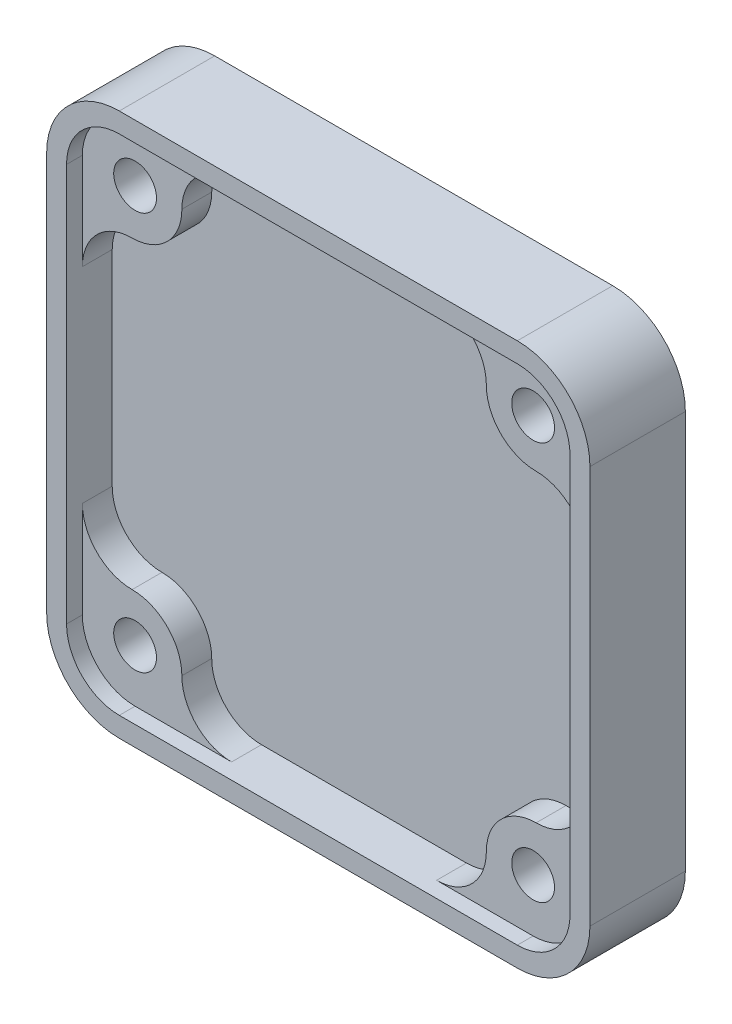
from build123d import *

# Parameters (mm, degrees)
WALL_EXTRUDE_BOSS_DEPTH         = 1.59
WALL_EXTRUDE_BOSS_DEPTH_BACK    = 8
FLOOR_EXTRUDE_BOSS_DEPTH        = 5
SCREWS_BLOCK_EXTRUDE_BOSS_DEPTH = 3
SCREWS_BLOCK_FILLET_R           = 5
SCREWS_HOLES_SKETCH_R           = 2.15
SCREWS_HOLES_EXTRUDE_DEPTH      = 75.39475788
SCREWS_HEADS_SKETCH_R           = 5
SCREWS_HEADS_EXTRUDE_DEPTH      = 3
CUT_EXTRUDE4_START              = -1
CUT_EXTRUDE4_DEPTH              = 1


# Read off the part's stored shape, not the designer's step: Screws_Block_Extrude_Boss, Cut-Extrude4
with BuildPart() as part:
    # Wall_Sketch → Wall-Extrude_Boss (new, two sides: drawn at the far end of the back side and taken through both)
    with BuildSketch(Plane.XY.offset(-WALL_EXTRUDE_BOSS_DEPTH_BACK)):
        with BuildLine():
            Line((-52.3, 44.999999897), (-52.29999, 5.00000605))
            ThreePointArc((-52.29999, 5.00000605), (-50.161874571, -0.161870293), (-45, -2.29999))
            Line((-45, -2.29999), (-5.000000575, -2.3))
            ThreePointArc((-5.000000575, -2.3), (0.161879299, -0.161879706), (2.3, 5))
            Line((2.3, 5), (2.3, 45))
            ThreePointArc((2.3, 45), (0.161879503, 50.161879503), (-5, 52.3))
            Line((-5, 52.3), (-45, 52.3))
            ThreePointArc((-45, 52.3), (-50.161879539, 50.161879466), (-52.3, 44.999999897))
        make_face()
        with BuildLine():
            Line((-5, 50.3), (-45, 50.3))
            ThreePointArc((-45, 50.3), (-48.747665967, 48.747665914), (-50.3, 44.999999925))
            Line((-50.3, 44.999999925), (-50.29999, 5.00000655))
            ThreePointArc((-50.29999, 5.00000655), (-48.747661185, 1.252343447), (-45, -0.29999))
            Line((-45, -0.29999), (-5.000000075, -0.3))
            ThreePointArc((-5.000000075, -0.3), (-1.252334086, 1.252334033), (0.3, 5))
            Line((0.3, 5), (0.3, 45))
            ThreePointArc((0.3, 45), (-1.25233406, 48.74766594), (-5, 50.3))
        make_face(mode=Mode.SUBTRACT)
    extrude(amount=WALL_EXTRUDE_BOSS_DEPTH + WALL_EXTRUDE_BOSS_DEPTH_BACK)

    # Floor_Sketch → Floor_Extrude_Boss (add)
    with BuildSketch(Plane(origin=(0, 0, -8), x_dir=(-1, 0, 0), z_dir=(0, 0, -1))):
        with BuildLine():
            Line((45, -0.29999), (5.000000075, -0.3))
            ThreePointArc((5.000000075, -0.3), (1.252334086, 1.252334033), (-0.3, 5))
            Line((-0.3, 5), (-0.3, 45))
            ThreePointArc((-0.3, 45), (1.25233406, 48.74766594), (5, 50.3))
            Line((5, 50.3), (45, 50.3))
            ThreePointArc((45, 50.3), (48.747665967, 48.747665914), (50.3, 44.999999925))
            Line((50.3, 44.999999925), (50.29999, 5.00000655))
            ThreePointArc((50.29999, 5.00000655), (48.747661185, 1.252343447), (45, -0.29999))
        make_face()
    extrude(amount=-FLOOR_EXTRUDE_BOSS_DEPTH)

    # Screws_Block_Extrude_Boss outline → Screws_Block_Extrude_Boss (add)
    with BuildSketch(Plane.XY.offset(-3)):
        with BuildLine():
            Line((-9.7, 9.700001175), (-9.7, -0.299998825))
            Line((-9.7, -0.299998825), (-5.000000075, -0.3))
            ThreePointArc((-5.000000075, -0.3), (-1.252334086, 1.252334033), (0.3, 5))
            Line((0.3, 5), (0.3, 9.700001175))
            Line((0.3, 9.700001175), (-9.7, 9.700001175))
        make_face()
        with BuildLine():
            Line((-45, -0.29999), (-40.299991175, -0.299991175))
            Line((-40.299991175, -0.299991175), (-40.299991175, 9.700008825))
            Line((-40.299991175, 9.700008825), (-50.299991175, 9.700008825))
            Line((-50.299991175, 9.700008825), (-50.29999, 5.00000655))
            ThreePointArc((-50.29999, 5.00000655), (-48.747661185, 1.252343447), (-45, -0.29999))
        make_face()
        with BuildLine():
            Line((-9.7, 40.3), (0.3, 40.3))
            Line((0.3, 40.3), (0.3, 45))
            ThreePointArc((0.3, 45), (-1.25233406, 48.74766594), (-5, 50.3))
            Line((-5, 50.3), (-9.7, 50.3))
            Line((-9.7, 50.3), (-9.7, 40.3))
        make_face()
        with BuildLine():
            Line((-50.3, 44.999999925), (-50.299998825, 40.3))
            Line((-50.299998825, 40.3), (-40.299998825, 40.3))
            Line((-40.299998825, 40.3), (-40.299998825, 50.3))
            Line((-40.299998825, 50.3), (-45, 50.3))
            ThreePointArc((-45, 50.3), (-48.747665967, 48.747665914), (-50.3, 44.999999925))
        make_face()
    extrude(amount=SCREWS_BLOCK_EXTRUDE_BOSS_DEPTH)

    # Screws_Block_Fillet
    screws_block_fillet_edges = [part.edges().sort_by_distance(p)[0] for p in [
        (-50.299991175, 9.700008825, -1.5),
        (-40.299991175, 9.700008825, -1.5),
        (-40.299991175, -0.299991175, -1.5),
        (-50.299998825, 40.3, -1.5),
        (-40.299998825, 40.3, -1.5),
        (-40.299998825, 50.3, -1.5),
        (-9.7, 50.3, -1.5),
        (-9.7, 40.3, -1.5),
        (0.3, 40.3, -1.5),
        (0.3, 9.700001175, -1.5),
        (-9.7, 9.700001175, -1.5),
        (-9.7, -0.299998825, -1.5),
    ]]
    fillet(screws_block_fillet_edges, radius=SCREWS_BLOCK_FILLET_R - 0.0001)  # a hair under: the kernel refuses the full size

    # Screws_Holes_Sketch → Screws_Holes_Extrude (cut, through all)
    with BuildSketch(Plane.XY):
        with Locations((-5, 5)):
            Circle(SCREWS_HOLES_SKETCH_R)
        with Locations((-45, 5)):
            Circle(SCREWS_HOLES_SKETCH_R)
        with Locations((-45, 45)):
            Circle(SCREWS_HOLES_SKETCH_R)
        with Locations((-5, 45)):
            Circle(SCREWS_HOLES_SKETCH_R)
    extrude(amount=-SCREWS_HOLES_EXTRUDE_DEPTH, mode=Mode.SUBTRACT)

    # Screws_Heads_Sketch → Screws_Heads_Extrude (cut)
    with BuildSketch(Plane(origin=(0, 0, -8), x_dir=(-1, 0, 0), z_dir=(0, 0, -1))):
        with Locations((45, 5)):
            Circle(SCREWS_HEADS_SKETCH_R)
        with Locations((5, 5)):
            Circle(SCREWS_HEADS_SKETCH_R)
        with Locations((5, 45)):
            Circle(SCREWS_HEADS_SKETCH_R)
        with Locations((45, 45)):
            Circle(SCREWS_HEADS_SKETCH_R)
    extrude(amount=-SCREWS_HEADS_EXTRUDE_DEPTH, mode=Mode.SUBTRACT)

    # Cut-Extrude4 outline → Cut-Extrude4 (cut)
    # profile 1 of 14: a face of its own
    with BuildSketch(Plane(origin=(0, 0, -8), x_dir=(-1, 0, 0), z_dir=(0, 0, -1)).offset(CUT_EXTRUDE4_START)):
        with BuildLine():
            ThreePointArc((19.123761695, 42.622498532), (18.934411444, 42.614903843), (18.745221079, 42.604031749))
            ThreePointArc((18.745221079, 42.604031749), (18.619538069, 42.592203309), (18.494705689, 42.5734148))
            ThreePointArc((18.494705689, 42.5734148), (18.087626591, 42.470620652), (17.698932182, 42.311886015))
            ThreePointArc((17.698932182, 42.311886015), (17.300891568, 42.087929952), (16.929634932, 41.821920255))
            ThreePointArc((16.929634932, 41.821920255), (16.582273109, 41.511117868), (16.270141999, 41.164949513))
            ThreePointArc((16.270141999, 41.164949513), (16.011325331, 40.801689535), (15.798724802, 40.409586367))
            ThreePointArc((15.798724802, 40.409586367), (15.6853018, 40.123326069), (15.606061538, 39.825784951))
            ThreePointArc((15.606061538, 39.825784951), (15.475921706, 39.165485257), (15.355293919, 38.503381792))
            ThreePointArc((15.355293919, 38.503381792), (15.159070376, 37.353469684), (14.972063775, 36.20202274))
            ThreePointArc((14.972063775, 36.20202274), (14.557345472, 33.574652855), (14.144970946, 30.946914086))
            Line((14.144970946, 30.946914086), (13.592079955, 27.413894941))
            Line((13.592079955, 27.413894941), (13.083114949, 24.162435465))
            Line((13.083114949, 24.162435465), (12.65627189, 21.436324101))
            Line((12.65627189, 21.436324101), (12.486328751, 20.352473169))
            ThreePointArc((12.486328751, 20.352473169), (12.375292894, 19.609879846), (12.275111645, 18.865744426))
            ThreePointArc((12.275111645, 18.865744426), (12.234683344, 18.432225131), (12.223399783, 17.996971059))
            ThreePointArc((12.223399783, 17.996971059), (12.243643483, 17.682469196), (12.299322501, 17.372273973))
            ThreePointArc((12.299322501, 17.372273973), (12.388882811, 17.077356444), (12.513420054, 16.795420506))
            ThreePointArc((12.513420054, 16.795420506), (12.641671398, 16.574357332), (12.791017084, 16.366961093))
            ThreePointArc((12.791017084, 16.366961093), (12.957806016, 16.178648993), (13.143100501, 16.008513904))
            ThreePointArc((13.143100501, 16.008513904), (13.341886898, 15.860907049), (13.555044655, 15.734940445))
            ThreePointArc((13.555044655, 15.734940445), (13.777539227, 15.633786256), (14.009726038, 15.557462673))
            ThreePointArc((14.009726038, 15.557462673), (14.142711858, 15.529832778), (14.278006197, 15.517829397))
            ThreePointArc((14.278006197, 15.517829397), (14.718184701, 15.505796966), (15.158427063, 15.496386429))
            ThreePointArc((15.158427063, 15.496386429), (15.723494794, 15.488387872), (16.288610035, 15.485181291))
            ThreePointArc((16.288610035, 15.485181291), (17.006182083, 15.485656305), (17.723745827, 15.489140798))
            Line((17.723745827, 15.489140798), (21.096939409, 15.512593896))
            Line((21.096939409, 15.512593896), (22.83747235, 20.523155813))
            Line((22.83747235, 20.523155813), (20.414647256, 20.571512746))
            ThreePointArc((20.414647256, 20.571512746), (19.949430871, 20.58112776), (19.484228588, 20.59140244))
            ThreePointArc((19.484228588, 20.59140244), (19.090883826, 20.600828364), (18.697562135, 20.611172328))
            Line((18.697562135, 20.611172328), (17.99097001, 20.630697503))
            ThreePointArc((17.99097001, 20.630697503), (17.980524729, 20.632893635), (17.971516234, 20.638618486))
            ThreePointArc((17.971516234, 20.638618486), (17.964776588, 20.645538808), (17.958808107, 20.653134263))
            ThreePointArc((17.958808107, 20.653134263), (17.938262816, 20.682473717), (17.917837458, 20.711896791))
            ThreePointArc((17.917837458, 20.711896791), (17.893829268, 20.746903426), (17.870076066, 20.782083579))
            ThreePointArc((17.870076066, 20.782083579), (17.843583735, 20.821848703), (17.817294628, 20.861748471))
            ThreePointArc((17.817294628, 20.861748471), (17.772687697, 20.954835972), (17.754155643, 21.056382139))
            ThreePointArc((17.754155643, 21.056382139), (17.751940897, 21.223854124), (17.761147971, 21.391087496))
            ThreePointArc((17.761147971, 21.391087496), (17.791783622, 21.68405394), (17.831239201, 21.975963409))
            ThreePointArc((17.831239201, 21.975963409), (17.932071843, 22.63811595), (18.035143302, 23.29992369))
            ThreePointArc((18.035143302, 23.29992369), (18.130210412, 23.904803633), (18.224914577, 24.509740507))
            Line((18.224914577, 24.509740507), (18.534636288, 26.493950226))
            Line((18.534636288, 26.493950226), (18.888566903, 28.765853079))
            Line((18.888566903, 28.765853079), (19.241578169, 31.036388406))
            ThreePointArc((19.241578169, 31.036388406), (19.586951938, 33.25505998), (19.933829888, 35.47349688))
            ThreePointArc((19.933829888, 35.47349688), (20.03795093, 36.105482584), (20.151968101, 36.735758085))
            ThreePointArc((20.151968101, 36.735758085), (20.219294178, 37.051078608), (20.301393346, 37.36287912))
            ThreePointArc((20.301393346, 37.36287912), (20.367912031, 37.490459319), (20.478787907, 37.582154373))
            ThreePointArc((20.478787907, 37.582154373), (20.581620409, 37.622233092), (20.691025378, 37.636772003))
            ThreePointArc((20.691025378, 37.636772003), (21.539992116, 37.646388357), (22.388976863, 37.654255822))
            ThreePointArc((22.388976863, 37.654255822), (23.568731809, 37.660954336), (24.748505586, 37.661614816))
            ThreePointArc((24.748505586, 37.661614816), (26.670313719, 37.656536197), (28.592113717, 37.648982295))
            Line((28.592113717, 37.648982295), (36.512871374, 37.612750922))
            Line((36.512871374, 37.612750922), (37.337097983, 39.9838204))
            ThreePointArc((37.337097983, 39.9838204), (37.495759016, 40.442082388), (37.653278487, 40.90073802))
            ThreePointArc((37.653278487, 40.90073802), (37.787524521, 41.295729879), (37.920229863, 41.691242026))
            ThreePointArc((37.920229863, 41.691242026), (38.03521891, 42.036765422), (38.149856847, 42.382405469))
            ThreePointArc((38.149856847, 42.382405469), (38.16037789, 42.424028902), (38.164802995, 42.466732778))
            ThreePointArc((38.164802995, 42.466732778), (38.147420747, 42.512167556), (38.102853481, 42.531666798))
            ThreePointArc((38.102853481, 42.531666798), (37.263157826, 42.544447381), (36.423444475, 42.556007034))
            ThreePointArc((36.423444475, 42.556007034), (35.215369871, 42.568446918), (34.007245224, 42.574264))
            ThreePointArc((34.007245224, 42.574264), (31.781812813, 42.577749373), (29.556378015, 42.578982607))
            ThreePointArc((29.556378015, 42.578982607), (27.870948513, 42.579790195), (26.185520338, 42.582053992))
            ThreePointArc((26.185520338, 42.582053992), (24.685311147, 42.58563383), (23.185107462, 42.59104992))
            ThreePointArc((23.185107462, 42.59104992), (21.917903203, 42.596836121), (20.650703239, 42.603496692))
            ThreePointArc((20.650703239, 42.603496692), (20.305409995, 42.608462683), (19.960257202, 42.61949148))
            ThreePointArc((19.960257202, 42.61949148), (19.754241264, 42.625943861), (19.548140363, 42.628516575))
            ThreePointArc((19.548140363, 42.628516575), (19.335925076, 42.627337687), (19.123761695, 42.622498532))
        make_face()
    # profile 2 of 14: a face of its own
    with BuildSketch(Plane(origin=(0, 0, -8), x_dir=(-1, 0, 0), z_dir=(0, 0, -1)).offset(CUT_EXTRUDE4_START)):
        with BuildLine():
            ThreePointArc((36.125034734, 12.571500526), (36.045323964, 12.550175375), (35.969318101, 12.518055636))
            ThreePointArc((35.969318101, 12.518055636), (35.901974952, 12.476940003), (35.841948991, 12.425729858))
            ThreePointArc((35.841948991, 12.425729858), (35.779931331, 12.345751915), (35.739780233, 12.252851156))
            ThreePointArc((35.739780233, 12.252851156), (35.707739685, 12.117321646), (35.689385254, 11.979271076))
            ThreePointArc((35.689385254, 11.979271076), (35.673662544, 11.731539613), (35.667269797, 11.483392047))
            ThreePointArc((35.667269797, 11.483392047), (35.664067543, 10.868458526), (35.663000351, 10.253517593))
            ThreePointArc((35.663000351, 10.253517593), (35.666624182, 9.420726364), (35.677496354, 8.587998222))
            ThreePointArc((35.677496354, 8.587998222), (35.705336811, 8.351701153), (35.779509695, 8.125626432))
            ThreePointArc((35.779509695, 8.125626432), (35.886974526, 7.988317087), (36.046720993, 7.918434239))
            ThreePointArc((36.046720993, 7.918434239), (36.383134185, 7.876537226), (36.721857169, 7.862539542))
            ThreePointArc((36.721857169, 7.862539542), (37.110299541, 7.874536999), (37.497261042, 7.910484356))
            ThreePointArc((37.497261042, 7.910484356), (37.662311334, 7.974511424), (37.777392164, 8.109038251))
            ThreePointArc((37.777392164, 8.109038251), (37.855900262, 8.323988139), (37.885191093, 8.550944133))
            ThreePointArc((37.885191093, 8.550944133), (37.896191248, 9.392244617), (37.89985835, 10.23360902))
            ThreePointArc((37.89985835, 10.23360902), (37.896243243, 11.071651144), (37.885397778, 11.909630886))
            ThreePointArc((37.885397778, 11.909630886), (37.856738917, 12.137999708), (37.779981103, 12.354983319))
            ThreePointArc((37.779981103, 12.354983319), (37.66767906, 12.489682426), (37.504886938, 12.554907603))
            ThreePointArc((37.504886938, 12.554907603), (37.134036002, 12.592221761), (36.761520777, 12.604678498))
            ThreePointArc((36.761520777, 12.604678498), (36.559088909, 12.602960877), (36.356715333, 12.597808481))
            ThreePointArc((36.356715333, 12.597808481), (36.240354333, 12.589240042), (36.125034734, 12.571500526))
        make_face()
        with BuildLine():
            ThreePointArc((36.968969941, 10.835758577), (36.978368655, 10.519850623), (36.984859417, 10.203869545))
            Line((36.984859417, 10.203869545), (37.009340843, 8.667808421))
            Line((37.009340843, 8.667808421), (36.55774355, 8.667808421))
            Line((36.55774355, 8.667808421), (36.55774355, 10.181415696))
            ThreePointArc((36.55774355, 10.181415696), (36.559746463, 10.676341169), (36.565755171, 11.171234219))
            ThreePointArc((36.565755171, 11.171234219), (36.57781847, 11.368640196), (36.607515251, 11.564172147))
            ThreePointArc((36.607515251, 11.564172147), (36.642240255, 11.653654538), (36.705486232, 11.725854749))
            ThreePointArc((36.705486232, 11.725854749), (36.783934067, 11.763419386), (36.87090367, 11.762213981))
            ThreePointArc((36.87090367, 11.762213981), (36.898180612, 11.745374605), (36.910655769, 11.715845525))
            ThreePointArc((36.910655769, 11.715845525), (36.927500431, 11.521132967), (36.942618143, 11.32627872))
            ThreePointArc((36.942618143, 11.32627872), (36.95816399, 11.081145967), (36.968969941, 10.835758577))
        make_face(mode=Mode.SUBTRACT)
    # profile 3 of 14: a face of its own
    with BuildSketch(Plane(origin=(0, 0, -8), x_dir=(-1, 0, 0), z_dir=(0, 0, -1)).offset(CUT_EXTRUDE4_START)):
        with BuildLine():
            ThreePointArc((34.850686979, 12.569319231), (34.429576841, 12.595834788), (34.007725432, 12.604678498))
            Line((34.007725432, 12.604678498), (33.068245073, 12.604678498))
            Line((33.068245073, 12.604678498), (33.068245073, 7.862539542))
            Line((33.068245073, 7.862539542), (33.962988272, 7.862539542))
            Line((33.962988272, 7.862539542), (33.965709097, 8.600702681))
            ThreePointArc((33.965709097, 8.600702681), (33.968267101, 8.876340795), (33.973909239, 9.151933029))
            ThreePointArc((33.973909239, 9.151933029), (33.992608396, 9.185050004), (34.030515526, 9.188122797))
            ThreePointArc((34.030515526, 9.188122797), (34.07634467, 9.154717216), (34.103300469, 9.104821042))
            ThreePointArc((34.103300469, 9.104821042), (34.191239561, 8.785952711), (34.276998756, 8.466491201))
            Line((34.276998756, 8.466491201), (34.436919519, 7.862539542))
            Line((34.436919519, 7.862539542), (35.380081925, 7.862539542))
            Line((35.380081925, 7.862539542), (34.934586781, 9.313178996))
            Line((34.934586781, 9.313178996), (35.119844971, 9.44293886))
            ThreePointArc((35.119844971, 9.44293886), (35.179892241, 9.497959882), (35.223675982, 9.566632813))
            ThreePointArc((35.223675982, 9.566632813), (35.257827655, 9.65762665), (35.277464275, 9.75281393))
            ThreePointArc((35.277464275, 9.75281393), (35.293838459, 9.92108804), (35.300554286, 10.090023494))
            ThreePointArc((35.300554286, 10.090023494), (35.303966035, 10.499875421), (35.305103071, 10.909739971))
            ThreePointArc((35.305103071, 10.909739971), (35.29945183, 11.476426311), (35.282499711, 12.042887228))
            ThreePointArc((35.282499711, 12.042887228), (35.245141689, 12.233794178), (35.151887604, 12.404512545))
            ThreePointArc((35.151887604, 12.404512545), (35.018714033, 12.518764993), (34.850686979, 12.569319231))
        make_face()
        with BuildLine():
            ThreePointArc((34.370767038, 11.439810448), (34.382217101, 11.183469249), (34.391348905, 10.927034999))
            Line((34.391348905, 10.927034999), (34.417075099, 10.09939754))
            Line((34.417075099, 10.09939754), (33.962988272, 10.09939754))
            Line((33.962988272, 10.09939754), (33.962988272, 10.955626608))
            ThreePointArc((33.962988272, 10.955626608), (33.963924728, 11.233390829), (33.966734383, 11.511142418))
            ThreePointArc((33.966734383, 11.511142418), (33.973158883, 11.603077751), (33.989869221, 11.693709668))
            ThreePointArc((33.989869221, 11.693709668), (34.011855801, 11.737455045), (34.050807317, 11.767117263))
            ThreePointArc((34.050807317, 11.767117263), (34.106408819, 11.783257208), (34.164305492, 11.783264067))
            ThreePointArc((34.164305492, 11.783264067), (34.223960075, 11.766458817), (34.27706613, 11.734508347))
            ThreePointArc((34.27706613, 11.734508347), (34.316266984, 11.691277429), (34.339973198, 11.637951688))
            ThreePointArc((34.339973198, 11.637951688), (34.360577171, 11.539690315), (34.370767038, 11.439810448))
        make_face(mode=Mode.SUBTRACT)
    # profile 4 of 14: a face of its own
    with BuildSketch(Plane(origin=(0, 0, -8), x_dir=(-1, 0, 0), z_dir=(0, 0, -1)).offset(CUT_EXTRUDE4_START)):
        with BuildLine():
            ThreePointArc((20.575881502, 12.577214982), (20.17563485, 12.597810601), (19.774917501, 12.604678498))
            Line((19.774917501, 12.604678498), (18.841828202, 12.604678498))
            Line((18.841828202, 12.604678498), (18.841828202, 7.862539542))
            Line((18.841828202, 7.862539542), (19.781308562, 7.862539542))
            ThreePointArc((19.781308562, 7.862539542), (20.196742392, 7.870293638), (20.611597503, 7.893545078))
            ThreePointArc((20.611597503, 7.893545078), (20.779938684, 7.937957567), (20.921175429, 8.039758374))
            ThreePointArc((20.921175429, 8.039758374), (21.01664325, 8.185480095), (21.053641981, 8.355715282))
            ThreePointArc((21.053641981, 8.355715282), (21.058818759, 8.771870633), (21.048525481, 9.187930874))
            ThreePointArc((21.048525481, 9.187930874), (21.039675061, 9.409907973), (21.032366688, 9.631941192))
            ThreePointArc((21.032366688, 9.631941192), (21.024782367, 9.906834436), (21.01821355, 10.18175382))
            ThreePointArc((21.01821355, 10.18175382), (21.012536448, 10.462727386), (21.00789224, 10.743719923))
            ThreePointArc((21.00789224, 10.743719923), (21.005025267, 10.98605562), (21.00354352, 11.228403746))
            ThreePointArc((21.00354352, 11.228403746), (20.996415129, 11.684413163), (20.978004417, 12.140106534))
            ThreePointArc((20.978004417, 12.140106534), (20.941695248, 12.301146094), (20.854037836, 12.441032741))
            ThreePointArc((20.854037836, 12.441032741), (20.728292864, 12.536357314), (20.575881502, 12.577214982))
        make_face()
        with BuildLine():
            ThreePointArc((20.144515248, 9.551555674), (20.156710808, 9.386197878), (20.166009306, 9.220651902))
            Line((20.166009306, 9.220651902), (20.19281268, 8.655066383))
            Line((20.19281268, 8.655066383), (19.942323506, 8.683805982))
            ThreePointArc((19.942323506, 8.683805982), (19.870008744, 8.696006997), (19.799387295, 8.715778199))
            ThreePointArc((19.799387295, 8.715778199), (19.757409285, 8.738834176), (19.7259814, 8.774973067))
            ThreePointArc((19.7259814, 8.774973067), (19.700772433, 8.829426512), (19.687567659, 8.887961148))
            ThreePointArc((19.687567659, 8.887961148), (19.674129433, 9.018100829), (19.664114024, 9.148548574))
            ThreePointArc((19.664114024, 9.148548574), (19.655881608, 9.329718914), (19.654205727, 9.511068455))
            ThreePointArc((19.654205727, 9.511068455), (19.664527216, 9.609990285), (19.693368279, 9.705175655))
            ThreePointArc((19.693368279, 9.705175655), (19.730259581, 9.76030649), (19.785736825, 9.796674779))
            ThreePointArc((19.785736825, 9.796674779), (19.860420412, 9.815715811), (19.937488582, 9.814881461))
            ThreePointArc((19.937488582, 9.814881461), (19.994557467, 9.800694792), (20.047538774, 9.775178126))
            ThreePointArc((20.047538774, 9.775178126), (20.085432433, 9.742310807), (20.110799087, 9.699035838))
            ThreePointArc((20.110799087, 9.699035838), (20.132915573, 9.626497906), (20.144515248, 9.551555674))
        make_face(mode=Mode.SUBTRACT)
        with BuildLine():
            ThreePointArc((20.110776361, 11.687935711), (20.136663224, 11.636185826), (20.153916046, 11.580954309))
            ThreePointArc((20.153916046, 11.580954309), (20.169577002, 11.493876619), (20.177473471, 11.405754911))
            ThreePointArc((20.177473471, 11.405754911), (20.182325487, 11.26230364), (20.183943001, 11.118779451))
            Line((20.183943001, 11.118779451), (20.183943001, 10.54676914))
            Line((20.183943001, 10.54676914), (19.647097082, 10.54676914))
            Line((19.647097082, 10.54676914), (19.647097082, 11.113439803))
            ThreePointArc((19.647097082, 11.113439803), (19.650082069, 11.334127796), (19.659034925, 11.554654317))
            ThreePointArc((19.659034925, 11.554654317), (19.67605766, 11.648002593), (19.715865791, 11.734136134))
            ThreePointArc((19.715865791, 11.734136134), (19.765440419, 11.779392083), (19.831273796, 11.792495938))
            ThreePointArc((19.831273796, 11.792495938), (19.938571902, 11.776496397), (20.042413685, 11.745099691))
            ThreePointArc((20.042413685, 11.745099691), (20.081354496, 11.722209577), (20.110776361, 11.687935711))
        make_face(mode=Mode.SUBTRACT)
    # profile 5 of 14: a face of its own
    with BuildSketch(Plane(origin=(0, 0, -8), x_dir=(-1, 0, 0), z_dir=(0, 0, -1)).offset(CUT_EXTRUDE4_START)):
        with BuildLine():
            Line((25.462927878, 10.822509936), (25.462927878, 12.604678498))
            Line((25.462927878, 12.604678498), (25.065573944, 12.604678498))
            ThreePointArc((25.065573944, 12.604678498), (24.987378172, 12.603023639), (24.909322434, 12.598061872))
            ThreePointArc((24.909322434, 12.598061872), (24.838638499, 12.590059073), (24.768515623, 12.578098899))
            ThreePointArc((24.768515623, 12.578098899), (24.712531309, 12.565288419), (24.657349149, 12.549373616))
            ThreePointArc((24.657349149, 12.549373616), (24.631674996, 12.535816406), (24.612298024, 12.514194819))
            ThreePointArc((24.612298024, 12.514194819), (24.596029628, 12.477767674), (24.589952617, 12.438338401))
            ThreePointArc((24.589952617, 12.438338401), (24.583908208, 12.10935925), (24.57852111, 11.780368678))
            ThreePointArc((24.57852111, 11.780368678), (24.574087267, 11.402112915), (24.572417798, 11.02383485))
            ThreePointArc((24.572417798, 11.02383485), (24.573106281, 10.583476117), (24.575841533, 10.14312534))
            Line((24.575841533, 10.14312534), (24.595307029, 7.862539542))
            Line((24.595307029, 7.862539542), (26.24478267, 7.862539542))
            Line((26.24478267, 7.862539542), (26.300242164, 8.198068241))
            ThreePointArc((26.300242164, 8.198068241), (26.328098762, 8.379235352), (26.35187511, 8.560982973))
            ThreePointArc((26.35187511, 8.560982973), (26.348919874, 8.625169714), (26.325342842, 8.684942574))
            ThreePointArc((26.325342842, 8.684942574), (26.285656518, 8.725589108), (26.231942747, 8.7440817))
            ThreePointArc((26.231942747, 8.7440817), (26.098438944, 8.753980445), (25.964609406, 8.757282741))
            ThreePointArc((25.964609406, 8.757282741), (25.87285478, 8.759239226), (25.78126695, 8.765105123))
            ThreePointArc((25.78126695, 8.765105123), (25.715803979, 8.774367622), (25.651762625, 8.790796242))
            ThreePointArc((25.651762625, 8.790796242), (25.606899297, 8.809227125), (25.565719019, 8.834851339))
            ThreePointArc((25.565719019, 8.834851339), (25.53693605, 8.863388659), (25.517237806, 8.898812057))
            ThreePointArc((25.517237806, 8.898812057), (25.501920765, 8.951330099), (25.495451704, 9.005652358))
            ThreePointArc((25.495451704, 9.005652358), (25.486670857, 9.263949894), (25.478881418, 9.522279229))
            ThreePointArc((25.478881418, 9.522279229), (25.471593546, 9.825781079), (25.466865016, 10.12933359))
            ThreePointArc((25.466865016, 10.12933359), (25.463912137, 10.475916172), (25.462927878, 10.822509936))
        make_face()
    # profile 6 of 14: a face of its own
    with BuildSketch(Plane(origin=(0, 0, -8), x_dir=(-1, 0, 0), z_dir=(0, 0, -1)).offset(CUT_EXTRUDE4_START)):
        with BuildLine():
            Line((31.323495923, 11.66519814), (31.371791835, 7.862539542))
            Line((31.371791835, 7.862539542), (32.259417352, 7.862539542))
            Line((32.259417352, 7.862539542), (32.307713353, 11.665198139))
            Line((32.307713353, 11.665198139), (32.559451142, 11.69405826))
            ThreePointArc((32.559451142, 11.69405826), (32.632174755, 11.704676427), (32.704105617, 11.719756895))
            ThreePointArc((32.704105617, 11.719756895), (32.737901209, 11.735329858), (32.763276506, 11.762546646))
            ThreePointArc((32.763276506, 11.762546646), (32.778292229, 11.799180389), (32.780461033, 11.838712646))
            ThreePointArc((32.780461033, 11.838712646), (32.76908476, 11.923248794), (32.754088478, 12.00721838))
            ThreePointArc((32.754088478, 12.00721838), (32.710113856, 12.209093742), (32.659594022, 12.409431395))
            ThreePointArc((32.659594022, 12.409431395), (32.624340019, 12.48388722), (32.565240757, 12.541278785))
            ThreePointArc((32.565240757, 12.541278785), (32.485173038, 12.580194976), (32.397487144, 12.595573323))
            ThreePointArc((32.397487144, 12.595573323), (32.131416481, 12.602401946), (31.865267941, 12.604678498))
            ThreePointArc((31.865267941, 12.604678498), (31.689117179, 12.603005021), (31.513030002, 12.597985282))
            ThreePointArc((31.513030002, 12.597985282), (31.391247336, 12.590005848), (31.270085391, 12.575360985))
            ThreePointArc((31.270085391, 12.575360985), (31.186723852, 12.559611211), (31.10484377, 12.537410899))
            ThreePointArc((31.10484377, 12.537410899), (31.056640866, 12.514283283), (31.016961645, 12.478450812))
            ThreePointArc((31.016961645, 12.478450812), (30.992759722, 12.445026992), (30.97316835, 12.408708085))
            ThreePointArc((30.97316835, 12.408708085), (30.949343874, 12.353361321), (30.927998492, 12.297012012))
            ThreePointArc((30.927998492, 12.297012012), (30.906818046, 12.232726408), (30.888438406, 12.167584724))
            ThreePointArc((30.888438406, 12.167584724), (30.873330083, 12.103128571), (30.861217544, 12.038042909))
            ThreePointArc((30.861217544, 12.038042909), (30.847616636, 11.943372899), (30.837467302, 11.848270919))
            ThreePointArc((30.837467302, 11.848270919), (30.84038627, 11.805884999), (30.856245546, 11.766469648))
            ThreePointArc((30.856245546, 11.766469648), (30.882265604, 11.737799851), (30.917316153, 11.721354191))
            ThreePointArc((30.917316153, 11.721354191), (30.991663193, 11.705560895), (31.066864516, 11.694530416))
            Line((31.066864516, 11.694530416), (31.323495923, 11.66519814))
        make_face()
    # profile 7 of 14: a face of its own
    with BuildSketch(Plane(origin=(0, 0, -8), x_dir=(-1, 0, 0), z_dir=(0, 0, -1)).offset(CUT_EXTRUDE4_START)):
        with BuildLine():
            ThreePointArc((29.140209332, 7.923494101), (29.444118736, 7.877816063), (29.751061788, 7.862539542))
            Line((29.751061788, 7.862539542), (30.450075707, 7.862539542))
            Line((30.450075707, 7.862539542), (30.505535201, 8.198068241))
            ThreePointArc((30.505535201, 8.198068241), (30.532331987, 8.374484093), (30.554510312, 8.551539853))
            ThreePointArc((30.554510312, 8.551539853), (30.550667249, 8.617491175), (30.525080419, 8.678398154))
            ThreePointArc((30.525080419, 8.678398154), (30.48219754, 8.721732773), (30.425253294, 8.743508527))
            ThreePointArc((30.425253294, 8.743508527), (30.281952745, 8.762306469), (30.137961095, 8.774748933))
            Line((30.137961095, 8.774748933), (29.712958075, 8.802019901))
            Line((29.712958075, 8.802019901), (29.712958075, 11.665198139))
            Line((29.712958075, 11.665198139), (30.584643384, 11.720625512))
            Line((30.584643384, 11.720625512), (30.530051344, 12.050809105))
            ThreePointArc((30.530051344, 12.050809105), (30.519252404, 12.118066611), (30.509079816, 12.185421698))
            ThreePointArc((30.509079816, 12.185421698), (30.499811777, 12.251093335), (30.491206426, 12.31685509))
            ThreePointArc((30.491206426, 12.31685509), (30.484384174, 12.373283981), (30.478099422, 12.429775261))
            ThreePointArc((30.478099422, 12.429775261), (30.475520392, 12.461261364), (30.474474549, 12.492835598))
            ThreePointArc((30.474474549, 12.492835598), (30.4645376, 12.524331115), (30.438682942, 12.544879768))
            ThreePointArc((30.438682942, 12.544879768), (30.378696775, 12.564910283), (30.31694284, 12.578548955))
            ThreePointArc((30.31694284, 12.578548955), (30.216649433, 12.591955198), (30.115703552, 12.598913936))
            ThreePointArc((30.115703552, 12.598913936), (29.95909449, 12.603237265), (29.802432395, 12.604678498))
            ThreePointArc((29.802432395, 12.604678498), (29.622237845, 12.602849697), (29.442117519, 12.59736442))
            ThreePointArc((29.442117519, 12.59736442), (29.333343396, 12.588390031), (29.225695871, 12.570380039))
            ThreePointArc((29.225695871, 12.570380039), (29.149094961, 12.548671529), (29.076186788, 12.516681578))
            ThreePointArc((29.076186788, 12.516681578), (29.01085218, 12.475906202), (28.952426356, 12.425729858))
            ThreePointArc((28.952426356, 12.425729858), (28.890408696, 12.345751915), (28.850257598, 12.252851156))
            ThreePointArc((28.850257598, 12.252851156), (28.81821705, 12.117321646), (28.799862619, 11.979271076))
            ThreePointArc((28.799862619, 11.979271076), (28.784139908, 11.731539613), (28.777747162, 11.483392047))
            ThreePointArc((28.777747162, 11.483392047), (28.774544908, 10.868458526), (28.773477716, 10.253517593))
            ThreePointArc((28.773477716, 10.253517593), (28.77701893, 9.43034831), (28.787640785, 8.607239943))
            ThreePointArc((28.787640785, 8.607239943), (28.81421997, 8.366444072), (28.884745475, 8.134678549))
            ThreePointArc((28.884745475, 8.134678549), (28.985971538, 7.997022928), (29.140209332, 7.923494101))
        make_face()
    # profile 8 of 14: a face of its own
    with BuildSketch(Plane(origin=(0, 0, -8), x_dir=(-1, 0, 0), z_dir=(0, 0, -1)).offset(CUT_EXTRUDE4_START)):
        with BuildLine():
            Line((26.626094037, 10.173959443), (26.626094037, 7.862539542))
            Line((26.626094037, 7.862539542), (28.303737536, 7.862539542))
            Line((28.303737536, 7.862539542), (28.359658986, 8.142146791))
            ThreePointArc((28.359658986, 8.142146791), (28.393074977, 8.325028858), (28.420376438, 8.508923145))
            ThreePointArc((28.420376438, 8.508923145), (28.417731894, 8.586673022), (28.390077034, 8.659386472))
            ThreePointArc((28.390077034, 8.659386472), (28.342638852, 8.711120207), (28.278009643, 8.738503155))
            ThreePointArc((28.278009643, 8.738503155), (28.134849721, 8.761036692), (27.990577416, 8.774748933))
            Line((27.990577416, 8.774748933), (27.565574397, 8.802019901))
            Line((27.565574397, 8.802019901), (27.565574397, 9.6967631))
            Line((27.565574397, 9.6967631), (28.236631796, 9.752302584))
            Line((28.236631796, 9.752302584), (28.236631796, 10.65023787))
            Line((28.236631796, 10.65023787), (27.565574397, 10.5915063))
            Line((27.565574397, 10.5915063), (27.565574397, 11.665198139))
            Line((27.565574397, 11.665198139), (28.035841043, 11.6922609))
            ThreePointArc((28.035841043, 11.6922609), (28.205091402, 11.704039953), (28.374010398, 11.719876701))
            ThreePointArc((28.374010398, 11.719876701), (28.420628686, 11.737377727), (28.452873332, 11.775322864))
            ThreePointArc((28.452873332, 11.775322864), (28.469123772, 11.829566942), (28.467526989, 11.886170362))
            ThreePointArc((28.467526989, 11.886170362), (28.419376381, 12.133789032), (28.369138611, 12.380992699))
            ThreePointArc((28.369138611, 12.380992699), (28.34822194, 12.44795392), (28.314658503, 12.509555933))
            ThreePointArc((28.314658503, 12.509555933), (28.274712591, 12.550343949), (28.22305371, 12.574648232))
            ThreePointArc((28.22305371, 12.574648232), (28.133025427, 12.592964484), (28.041437214, 12.600187782))
            ThreePointArc((28.041437214, 12.600187782), (27.787751037, 12.603555746), (27.534044988, 12.604678498))
            ThreePointArc((27.534044988, 12.604678498), (27.38076528, 12.6035973), (27.227516079, 12.600353847))
            ThreePointArc((27.227516079, 12.600353847), (27.093457542, 12.595161646), (26.959537538, 12.587156474))
            ThreePointArc((26.959537538, 12.587156474), (26.847876369, 12.578643393), (26.736323268, 12.568815133))
            ThreePointArc((26.736323268, 12.568815133), (26.708956298, 12.561338921), (26.685743614, 12.545028922))
            ThreePointArc((26.685743614, 12.545028922), (26.668216408, 12.51919875), (26.661472362, 12.488720585))
            ThreePointArc((26.661472362, 12.488720585), (26.65226134, 12.156328803), (26.643616062, 11.823921825))
            ThreePointArc((26.643616062, 11.823921825), (26.635534267, 11.444165715), (26.630394262, 11.064358396))
            ThreePointArc((26.630394262, 11.064358396), (26.627168993, 10.619164112), (26.626094037, 10.173959443))
        make_face()
    # profile 9 of 14: a face of its own
    with BuildSketch(Plane(origin=(0, 0, -8), x_dir=(-1, 0, 0), z_dir=(0, 0, -1)).offset(CUT_EXTRUDE4_START)):
        with BuildLine():
            Line((12.041779887, 10.05466038), (12.041779887, 7.862539542))
            Line((12.041779887, 7.862539542), (13.718377878, 7.862539542))
            Line((13.718377878, 7.862539542), (13.773837372, 8.198068241))
            ThreePointArc((13.773837372, 8.198068241), (13.800634158, 8.374484093), (13.822812484, 8.551539853))
            ThreePointArc((13.822812484, 8.551539853), (13.81896942, 8.617491175), (13.79338259, 8.678398154))
            ThreePointArc((13.79338259, 8.678398154), (13.750499711, 8.721732773), (13.693555465, 8.743508527))
            ThreePointArc((13.693555465, 8.743508527), (13.550254916, 8.762306469), (13.406263266, 8.774748933))
            Line((13.406263266, 8.774748933), (12.981260246, 8.802019901))
            Line((12.981260246, 8.802019901), (12.981260246, 11.665198139))
            Line((12.981260246, 11.665198139), (13.852945556, 11.720625512))
            Line((13.852945556, 11.720625512), (13.798353515, 12.050809105))
            ThreePointArc((13.798353515, 12.050809105), (13.787554575, 12.118066611), (13.777381987, 12.185421698))
            ThreePointArc((13.777381987, 12.185421698), (13.768113948, 12.251093335), (13.759508597, 12.31685509))
            ThreePointArc((13.759508597, 12.31685509), (13.752686345, 12.373283981), (13.746401593, 12.429775261))
            ThreePointArc((13.746401593, 12.429775261), (13.743822564, 12.461261364), (13.74277672, 12.492835598))
            ThreePointArc((13.74277672, 12.492835598), (13.732839771, 12.524331115), (13.706985113, 12.544879768))
            ThreePointArc((13.706985113, 12.544879768), (13.646998946, 12.564910283), (13.585245011, 12.578548955))
            ThreePointArc((13.585245011, 12.578548955), (13.484951604, 12.591955198), (13.384005724, 12.598913936))
            ThreePointArc((13.384005724, 12.598913936), (13.227396662, 12.603237265), (13.070734566, 12.604678498))
            ThreePointArc((13.070734566, 12.604678498), (12.890540016, 12.602849697), (12.71041969, 12.59736442))
            ThreePointArc((12.71041969, 12.59736442), (12.601645567, 12.588390031), (12.493998042, 12.570380039))
            ThreePointArc((12.493998042, 12.570380039), (12.417397133, 12.548671529), (12.344488959, 12.516681578))
            ThreePointArc((12.344488959, 12.516681578), (12.279154351, 12.475906202), (12.220728527, 12.425729858))
            ThreePointArc((12.220728527, 12.425729858), (12.157463687, 12.343280413), (12.117695447, 12.247265633))
            ThreePointArc((12.117695447, 12.247265633), (12.085909563, 12.101821227), (12.067800451, 11.954049518))
            ThreePointArc((12.067800451, 11.954049518), (12.052209083, 11.685608085), (12.045919864, 11.416787811))
            ThreePointArc((12.045919864, 11.416787811), (12.042814658, 10.735727242), (12.041779887, 10.05466038))
        make_face()
    # profile 10 of 14: a face of its own
    with BuildSketch(Plane(origin=(0, 0, -8), x_dir=(-1, 0, 0), z_dir=(0, 0, -1)).offset(CUT_EXTRUDE4_START)):
        with BuildLine():
            ThreePointArc((34.479853234, 30.922193137), (34.340768813, 30.906583413), (34.203315759, 30.880224402))
            ThreePointArc((34.203315759, 30.880224402), (34.140003524, 30.84812254), (34.098779063, 30.790334026))
            ThreePointArc((34.098779063, 30.790334026), (33.998875033, 30.530284795), (33.905191262, 30.267930514))
            ThreePointArc((33.905191262, 30.267930514), (33.601182117, 29.381841609), (33.298170901, 28.495410952))
            Line((33.298170901, 28.495410952), (32.637067072, 26.556619829))
            ThreePointArc((32.637067072, 26.556619829), (32.624949316, 26.50842407), (32.620873473, 26.458895708))
            ThreePointArc((32.620873473, 26.458895708), (32.629811247, 26.436820162), (32.65158956, 26.427180731))
            ThreePointArc((32.65158956, 26.427180731), (32.939355327, 26.418382428), (33.227145112, 26.410408322))
            ThreePointArc((33.227145112, 26.410408322), (33.56122967, 26.403618888), (33.895371365, 26.400805401))
            ThreePointArc((33.895371365, 26.400805401), (34.294316954, 26.401222098), (34.693249756, 26.404443337))
            Line((34.693249756, 26.404443337), (36.765626128, 26.428460929))
            Line((36.765626128, 26.428460929), (37.099404173, 27.412678448))
            ThreePointArc((37.099404173, 27.412678448), (37.178925706, 27.646497198), (37.258853495, 27.880177386))
            ThreePointArc((37.258853495, 27.880177386), (37.362276206, 28.181289368), (37.465946998, 28.482316027))
            ThreePointArc((37.465946998, 28.482316027), (37.574658977, 28.797143081), (37.683627819, 29.111881322))
            ThreePointArc((37.683627819, 29.111881322), (37.780902265, 29.391949395), (37.878499845, 29.671905027))
            Line((37.878499845, 29.671905027), (38.323817562, 30.946914086))
            Line((38.323817562, 30.946914086), (36.242450005, 30.946914086))
            ThreePointArc((36.242450005, 30.946914086), (35.620390286, 30.945889512), (34.998337323, 30.942814641))
            ThreePointArc((34.998337323, 30.942814641), (34.738924306, 30.936802641), (34.479853234, 30.922193137))
        make_face()
    # profile 11 of 14: a face of its own
    with BuildSketch(Plane(origin=(0, 0, -8), x_dir=(-1, 0, 0), z_dir=(0, 0, -1)).offset(CUT_EXTRUDE4_START)):
        with BuildLine():
            ThreePointArc((26.983991317, 36.307932061), (26.981179124, 36.234698514), (26.972759158, 36.161896281))
            Line((26.972759158, 36.161896281), (25.633848166, 27.510033577))
            ThreePointArc((25.633848166, 27.510033577), (25.040804232, 23.681007107), (24.446887296, 19.85211595))
            ThreePointArc((24.446887296, 19.85211595), (24.217018639, 18.384690091), (23.983091969, 16.91790566))
            ThreePointArc((23.983091969, 16.91790566), (23.940774404, 16.654166778), (23.89868789, 16.390390928))
            ThreePointArc((23.89868789, 16.390390928), (23.862982643, 16.164962948), (23.82759258, 15.939485272))
            Line((23.82759258, 15.939485272), (23.765399875, 15.540779023))
            ThreePointArc((23.765399875, 15.540779023), (23.763537751, 15.524780067), (23.762915799, 15.508685121))
            ThreePointArc((23.762915799, 15.508685121), (23.767776782, 15.496872735), (23.779543886, 15.491903139))
            Line((23.779543886, 15.491903139), (25.111398664, 15.479850053))
            ThreePointArc((25.111398664, 15.479850053), (25.852310556, 15.47429045), (26.593235041, 15.470790599))
            ThreePointArc((26.593235041, 15.470790599), (27.473364162, 15.468590519), (28.353495726, 15.467856736))
            Line((28.353495726, 15.467856736), (32.944075743, 15.467856736))
            Line((32.944075743, 15.467856736), (33.8053976, 17.946704028))
            ThreePointArc((33.8053976, 17.946704028), (33.970024395, 18.424054998), (34.132439303, 18.902163069))
            ThreePointArc((34.132439303, 18.902163069), (34.268140518, 19.309727241), (34.400785314, 19.718296368))
            ThreePointArc((34.400785314, 19.718296368), (34.515698213, 20.07771303), (34.630089117, 20.437296166))
            ThreePointArc((34.630089117, 20.437296166), (34.632906491, 20.467813111), (34.622733523, 20.496722146))
            ThreePointArc((34.622733523, 20.496722146), (34.601412773, 20.517458874), (34.572829847, 20.525680957))
            ThreePointArc((34.572829847, 20.525680957), (34.243392403, 20.536673431), (33.913932992, 20.546986582))
            ThreePointArc((33.913932992, 20.546986582), (33.536632222, 20.556641524), (33.159257635, 20.562766094))
            ThreePointArc((33.159257635, 20.562766094), (32.715417787, 20.566611365), (32.271563133, 20.567892973))
            ThreePointArc((32.271563133, 20.567892973), (31.57673975, 20.568950117), (30.881922797, 20.572120903))
            ThreePointArc((30.881922797, 20.572120903), (30.590510741, 20.578299659), (30.299418579, 20.593283548))
            ThreePointArc((30.299418579, 20.593283548), (30.138524282, 20.609792532), (29.979217993, 20.637739401))
            ThreePointArc((29.979217993, 20.637739401), (29.890361823, 20.671778208), (29.816299841, 20.73151833))
            ThreePointArc((29.816299841, 20.73151833), (29.785573158, 20.769785512), (29.759567396, 20.811405298))
            ThreePointArc((29.759567396, 20.811405298), (29.733733945, 20.863133591), (29.711719124, 20.916598824))
            ThreePointArc((29.711719124, 20.916598824), (29.693357718, 20.972318265), (29.679051245, 21.029213977))
            ThreePointArc((29.679051245, 21.029213977), (29.67093601, 21.080225959), (29.668220915, 21.131808006))
            ThreePointArc((29.668220915, 21.131808006), (29.67171008, 21.224848619), (29.682158061, 21.317366561))
            Line((29.682158061, 21.317366561), (30.009900974, 23.482832105))
            ThreePointArc((30.009900974, 23.482832105), (30.196811136, 24.709522446), (30.385497348, 25.935940856))
            ThreePointArc((30.385497348, 25.935940856), (30.607789965, 27.369550415), (30.831387074, 28.802957095))
            ThreePointArc((30.831387074, 28.802957095), (31.054602192, 30.231163079), (31.277357417, 31.659440864))
            ThreePointArc((31.277357417, 31.659440864), (31.465434565, 32.86874571), (31.652873174, 34.078149692))
            Line((31.652873174, 34.078149692), (31.989359339, 36.253571222))
            ThreePointArc((31.989359339, 36.253571222), (31.993252853, 36.28725832), (31.994553234, 36.321144734))
            ThreePointArc((31.994553234, 36.321144734), (31.984289377, 36.346627707), (31.959228414, 36.3578828))
            ThreePointArc((31.959228414, 36.3578828), (31.630970837, 36.370284862), (31.30267856, 36.381731643))
            ThreePointArc((31.30267856, 36.381731643), (30.905400132, 36.392764117), (30.508022587, 36.39931791))
            ThreePointArc((30.508022587, 36.39931791), (29.998654935, 36.403465201), (29.489272275, 36.404847602))
            ThreePointArc((29.489272275, 36.404847602), (28.915568106, 36.403553874), (28.341875607, 36.399672766))
            ThreePointArc((28.341875607, 36.399672766), (27.963166475, 36.393449358), (27.584591179, 36.381613716))
            ThreePointArc((27.584591179, 36.381613716), (27.307193134, 36.369918946), (27.029882875, 36.356300447))
            ThreePointArc((27.029882875, 36.356300447), (26.997289828, 36.341269509), (26.983991317, 36.307932061))
        make_face()
    # profile 12 of 14: a face of its own
    with BuildSketch(Plane(origin=(0, 0, -8), x_dir=(-1, 0, 0), z_dir=(0, 0, -1)).offset(CUT_EXTRUDE4_START)):
        with BuildLine():
            ThreePointArc((14.279984832, 12.57907918), (14.232819808, 12.566460496), (14.187897146, 12.547336554))
            ThreePointArc((14.187897146, 12.547336554), (14.160169765, 12.526001262), (14.141905377, 12.496161448))
            ThreePointArc((14.141905377, 12.496161448), (14.128838716, 12.450386415), (14.124021787, 12.403027271))
            ThreePointArc((14.124021787, 12.403027271), (14.120126565, 12.079487636), (14.116861604, 11.755941026))
            ThreePointArc((14.116861604, 11.755941026), (14.114577537, 11.381867367), (14.114544667, 11.007786736))
            ThreePointArc((14.114544667, 11.007786736), (14.116652984, 10.575148034), (14.120449435, 10.142520852))
            Line((14.120449435, 10.142520852), (14.144426406, 7.907276702))
            Line((14.144426406, 7.907276702), (15.776052277, 7.856137296))
            Line((15.776052277, 7.856137296), (15.832614006, 8.138945669))
            ThreePointArc((15.832614006, 8.138945669), (15.867104764, 8.32621608), (15.895864923, 8.514451763))
            ThreePointArc((15.895864923, 8.514451763), (15.893949531, 8.591834266), (15.867628975, 8.664628146))
            ThreePointArc((15.867628975, 8.664628146), (15.822439765, 8.714207783), (15.759886057, 8.738440791))
            ThreePointArc((15.759886057, 8.738440791), (15.6244298, 8.752566636), (15.48832067, 8.757282741))
            Line((15.48832067, 8.757282741), (15.087465606, 8.757282741))
            Line((15.087465606, 8.757282741), (15.039169605, 12.559941338))
            Line((15.039169605, 12.559941338), (14.613253947, 12.587249617))
            ThreePointArc((14.613253947, 12.587249617), (14.516123712, 12.591758282), (14.418894877, 12.592837288))
            ThreePointArc((14.418894877, 12.592837288), (14.349122593, 12.589161499), (14.279984832, 12.57907918))
        make_face()
    # profile 13 of 14: a face of its own
    with BuildSketch(Plane(origin=(0, 0, -8), x_dir=(-1, 0, 0), z_dir=(0, 0, -1)).offset(CUT_EXTRUDE4_START)):
        with BuildLine():
            ThreePointArc((24.17526205, 8.748835112), (24.014733956, 8.755170441), (23.854094784, 8.757282741))
            Line((23.854094784, 8.757282741), (23.405018519, 8.757282741))
            Line((23.405018519, 8.757282741), (23.405018519, 9.730697936))
            Line((23.405018519, 9.730697936), (23.740547219, 9.758467723))
            ThreePointArc((23.740547219, 9.758467723), (23.84693822, 9.769622099), (23.952739237, 9.785421146))
            ThreePointArc((23.952739237, 9.785421146), (23.997647131, 9.802055911), (24.03352408, 9.833777811))
            ThreePointArc((24.03352408, 9.833777811), (24.058583403, 9.878570501), (24.06907688, 9.928812333))
            ThreePointArc((24.06907688, 9.928812333), (24.07432582, 10.058795014), (24.076075919, 10.18887186))
            ThreePointArc((24.076075919, 10.18887186), (24.074482841, 10.319061621), (24.069704453, 10.449173415))
            ThreePointArc((24.069704453, 10.449173415), (24.05988002, 10.49746792), (24.036071682, 10.540619301))
            ThreePointArc((24.036071682, 10.540619301), (24.002388334, 10.569801519), (23.959973683, 10.583482422))
            ThreePointArc((23.959973683, 10.583482422), (23.861594581, 10.592034903), (23.762915799, 10.59578863))
            Line((23.762915799, 10.59578863), (23.449755679, 10.600070961))
            Line((23.449755679, 10.600070961), (23.396479538, 11.709935299))
            Line((23.396479538, 11.709935299), (24.315490946, 11.709935299))
            Line((24.315490946, 11.709935299), (24.252568041, 12.090201159))
            ThreePointArc((24.252568041, 12.090201159), (24.239576425, 12.165556911), (24.225570239, 12.240730697))
            ThreePointArc((24.225570239, 12.240730697), (24.211613722, 12.3097291), (24.196467911, 12.378476233))
            ThreePointArc((24.196467911, 12.378476233), (24.182935967, 12.435650977), (24.168614287, 12.492633029))
            ThreePointArc((24.168614287, 12.492633029), (24.160862739, 12.515759683), (24.149948602, 12.537572758))
            ThreePointArc((24.149948602, 12.537572758), (24.132270398, 12.555917603), (24.108239432, 12.564377207))
            ThreePointArc((24.108239432, 12.564377207), (23.997644882, 12.575391639), (23.88691638, 12.584966143))
            ThreePointArc((23.88691638, 12.584966143), (23.753417649, 12.59401153), (23.619739171, 12.599824874))
            ThreePointArc((23.619739171, 12.599824874), (23.465020461, 12.603464985), (23.310263693, 12.604678498))
            ThreePointArc((23.310263693, 12.604678498), (23.156385854, 12.603469274), (23.002546028, 12.599841696))
            ThreePointArc((23.002546028, 12.599841696), (22.871711125, 12.594064061), (22.741065112, 12.584966143))
            ThreePointArc((22.741065112, 12.584966143), (22.633328148, 12.575392348), (22.525722703, 12.564438855))
            ThreePointArc((22.525722703, 12.564438855), (22.506488461, 12.555825752), (22.495954239, 12.537572758))
            ThreePointArc((22.495954239, 12.537572758), (22.491644534, 12.5109036), (22.490021108, 12.483937288))
            Line((22.490021108, 12.483937288), (22.483476061, 11.813510145))
            ThreePointArc((22.483476061, 11.813510145), (22.480243409, 11.434164748), (22.477703446, 11.054814081))
            ThreePointArc((22.477703446, 11.054814081), (22.475390613, 10.610864441), (22.473585659, 10.166912446))
            Line((22.473585659, 10.166912446), (22.46553816, 7.863357874))
            Line((22.46553816, 7.863357874), (24.117403749, 7.862539542))
            Line((24.117403749, 7.862539542), (24.16945973, 8.108593921))
            ThreePointArc((24.16945973, 8.108593921), (24.21914694, 8.348582317), (24.266752584, 8.588992282))
            ThreePointArc((24.266752584, 8.588992282), (24.268430955, 8.6444786), (24.252472393, 8.697646944))
            ThreePointArc((24.252472393, 8.697646944), (24.220852103, 8.733776765), (24.17526205, 8.748835112))
        make_face()
    # profile 14 of 14: a face of its own
    with BuildSketch(Plane(origin=(0, 0, -8), x_dir=(-1, 0, 0), z_dir=(0, 0, -1)).offset(CUT_EXTRUDE4_START)):
        with BuildLine():
            ThreePointArc((16.38566623, 12.586412137), (16.32661871, 12.58063339), (16.267823093, 12.572691161))
            ThreePointArc((16.267823093, 12.572691161), (16.242720659, 12.56462751), (16.221373036, 12.549153867))
            ThreePointArc((16.221373036, 12.549153867), (16.167232915, 12.467993299), (16.148419076, 12.372263315))
            ThreePointArc((16.148419076, 12.372263315), (16.152338878, 11.419072346), (16.158271809, 10.465891781))
            ThreePointArc((16.158271809, 10.465891781), (16.166832029, 9.549826096), (16.179171847, 8.633803527))
            ThreePointArc((16.179171847, 8.633803527), (16.199213349, 8.438924014), (16.252670527, 8.250451161))
            ThreePointArc((16.252670527, 8.250451161), (16.30396235, 8.139007919), (16.369895307, 8.035551202))
            ThreePointArc((16.369895307, 8.035551202), (16.43617527, 7.968932217), (16.518954514, 7.924449418))
            ThreePointArc((16.518954514, 7.924449418), (16.642398936, 7.890387307), (16.769590516, 7.875519402))
            ThreePointArc((16.769590516, 7.875519402), (17.047755961, 7.867061418), (17.326032117, 7.863909662))
            ThreePointArc((17.326032117, 7.863909662), (17.693916732, 7.875690366), (18.060165243, 7.912295048))
            ThreePointArc((18.060165243, 7.912295048), (18.219458653, 7.977227827), (18.327144356, 8.111371204))
            ThreePointArc((18.327144356, 8.111371204), (18.399646329, 8.329656558), (18.426380056, 8.55810861))
            ThreePointArc((18.426380056, 8.55810861), (18.435990066, 9.448098602), (18.439193763, 10.33813471))
            Line((18.439193763, 10.33813471), (18.439193763, 12.559941338))
            Line((18.439193763, 12.559941338), (17.589187723, 12.614483273))
            Line((17.589187723, 12.614483273), (17.587965951, 10.842463067))
            ThreePointArc((17.587965951, 10.842463067), (17.586748899, 10.495700266), (17.583575446, 10.14894985))
            ThreePointArc((17.583575446, 10.14894985), (17.578647912, 9.840368753), (17.571255012, 9.531836876))
            ThreePointArc((17.571255012, 9.531836876), (17.563387195, 9.271911514), (17.554319133, 9.012025256))
            ThreePointArc((17.554319133, 9.012025256), (17.547573274, 8.939970336), (17.532793312, 8.869125641))
            ThreePointArc((17.532793312, 8.869125641), (17.507466781, 8.80148571), (17.469644753, 8.739954518))
            ThreePointArc((17.469644753, 8.739954518), (17.426298813, 8.699308533), (17.371881532, 8.675439596))
            ThreePointArc((17.371881532, 8.675439596), (17.316670704, 8.672584572), (17.264401668, 8.690593862))
            ThreePointArc((17.264401668, 8.690593862), (17.212936893, 8.729439907), (17.172483805, 8.779651321))
            ThreePointArc((17.172483805, 8.779651321), (17.152701148, 8.823037559), (17.144488274, 8.870008484))
            ThreePointArc((17.144488274, 8.870008484), (17.132982382, 9.133702554), (17.122606255, 9.397443495))
            ThreePointArc((17.122606255, 9.397443495), (17.112785338, 9.7060122), (17.106274597, 10.014668491))
            ThreePointArc((17.106274597, 10.014668491), (17.101934276, 10.370182261), (17.100097559, 10.72571778))
            Line((17.100097559, 10.72571778), (17.097078964, 12.559941338))
            Line((17.097078964, 12.559941338), (16.691113216, 12.586434863))
            ThreePointArc((16.691113216, 12.586434863), (16.61108868, 12.590416737), (16.530979326, 12.591924381))
            ThreePointArc((16.530979326, 12.591924381), (16.458265878, 12.590668254), (16.38566623, 12.586412137))
        make_face()
    extrude(amount=CUT_EXTRUDE4_DEPTH, mode=Mode.SUBTRACT)


solid = part.part
